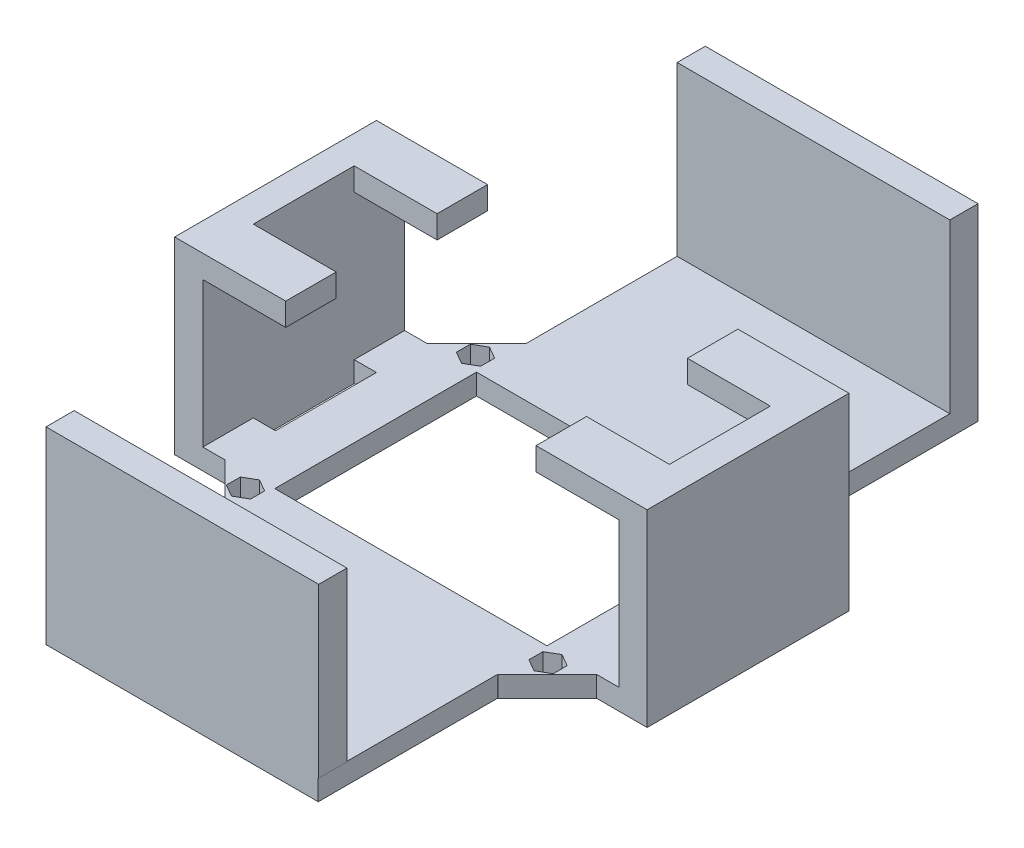
from build123d import *

# Parameters (mm, degrees)
BOSS_EXTRUDE1_DEPTH   = 20
BOSS_EXTRUDE1_2_DEPTH = 20
BOSS_EXTRUDE1_3_DEPTH = 20
BOSS_EXTRUDE1_4_DEPTH = 20
SKETCH6_W             = 12
SKETCH6_H             = 5
BOSS_EXTRUDE5_DEPTH   = 65.8
SKETCH7_W             = 12
SKETCH7_H             = 5
BOSS_EXTRUDE6_DEPTH   = 48.7
SKETCH8_W             = 12.175
SKETCH8_H             = 5
BOSS_EXTRUDE7_DEPTH   = 12.16
SKETCH9_W             = 12.175
SKETCH9_H             = 5
BOSS_EXTRUDE8_DEPTH   = 12.16
SKETCH11_W            = 6.8
SKETCH11_H            = 12.175
BOSS_EXTRUDE9_DEPTH   = 40.5
SKETCH12_W            = 12.175
SKETCH12_H            = 5.5
BOSS_EXTRUDE10_DEPTH  = 20
SKETCH13_W            = 12.175
SKETCH13_H            = 5.5
BOSS_EXTRUDE11_DEPTH  = 20
SKETCH14_W            = 12.175
SKETCH14_H            = 5
BOSS_EXTRUDE12_DEPTH  = 43.2
SKETCH15_W            = 12.175
SKETCH15_H            = 5
BOSS_EXTRUDE13_DEPTH  = 43.2
SKETCH16_W            = 12.175
SKETCH16_H            = 6.8
BOSS_EXTRUDE14_DEPTH  = 40.5
SKETCH17_W            = 16.970562748
SKETCH17_H            = 15
CUT_EXTRUDE1_DEPTH    = 10
SKETCH18_W            = 16.970562748
SKETCH18_H            = 15
CUT_EXTRUDE2_DEPTH    = 10
SKETCH19_W            = 16.970562748
SKETCH19_H            = 15
CUT_EXTRUDE3_DEPTH    = 10
SKETCH20_W            = 16.970562748
SKETCH20_H            = 15
CUT_EXTRUDE4_DEPTH    = 10
BOSS_EXTRUDE15_DEPTH  = 50
BOSS_EXTRUDE19_DEPTH  = 30


with BuildPart() as part:
    # Sketch2 → Boss-Extrude1 (new body)
    with BuildSketch(Plane(origin=(0, 0, 0), x_dir=(1, 0, 0), z_dir=(0, 1, 0))):
        Polygon((-32.84355613, 36.339660101), (-32.84355613, 24.339660101), (-44.84355613, 24.339660101), align=None)
        Polygon((-33.575, 29.438749537), (-33.575, 26.061250463), (-36.5, 24.372500925), (-39.425, 26.061250463), (-39.425, 29.438749537), (-36.5, 31.127499075), align=None, mode=Mode.SUBTRACT)
    extrude(amount=BOSS_EXTRUDE1_DEPTH)



with BuildPart() as body_2:
    # Sketch2 → Boss-Extrude1 2 (new body)
    with BuildSketch(Plane(origin=(0, 0, 0), x_dir=(1, 0, 0), z_dir=(0, 1, 0))):
        Polygon((32.84355613, 24.339660101), (44.84355613, 24.339660101), (32.84355613, 36.339660101), align=None)
        Polygon((33.575, 29.438749537), (33.575, 26.061250463), (36.5, 24.372500925), (39.425, 26.061250463), (39.425, 29.438749537), (36.5, 31.127499075), align=None, mode=Mode.SUBTRACT)
    extrude(amount=BOSS_EXTRUDE1_2_DEPTH)


with BuildPart() as body_3:
    # Sketch2 → Boss-Extrude1 3 (new body)
    with BuildSketch(Plane(origin=(0, 0, 0), x_dir=(1, 0, 0), z_dir=(0, 1, 0))):
        Polygon((44.84355613, -24.339660101), (32.84355613, -36.339660101), (32.84355613, -24.339660101), align=None)
        Polygon((39.425, -26.061250463), (39.425, -29.438749537), (36.5, -31.127499075), (33.575, -29.438749537), (33.575, -26.061250463), (36.5, -24.372500925), align=None, mode=Mode.SUBTRACT)
    extrude(amount=BOSS_EXTRUDE1_3_DEPTH)


with BuildPart() as body_4:
    # Sketch2 → Boss-Extrude1 4 (new body)
    with BuildSketch(Plane(origin=(0, 0, 0), x_dir=(1, 0, 0), z_dir=(0, 1, 0))):
        Polygon((-44.84355613, -24.339660101), (-32.84355613, -36.339660101), (-32.84355613, -24.339660101), align=None)
        Polygon((-36.5, -31.127499075), (-33.575, -29.438749537), (-33.575, -26.061250463), (-36.5, -24.372500925), (-39.425, -26.061250463), (-39.425, -29.438749537), align=None, mode=Mode.SUBTRACT)
    extrude(amount=BOSS_EXTRUDE1_4_DEPTH)


with BuildPart() as part_1:
    add(part.part)

    add(body_2.part)  # Boss-Extrude5 merges body 2

    add(body_3.part)  # Boss-Extrude5 merges body 3

    add(body_4.part)  # Boss-Extrude5 merges body 4
    # Sketch6 → Boss-Extrude5 (add)
    with BuildSketch(Plane(origin=(-32.84355613, 0, 0), x_dir=(0, 0, -1), z_dir=(1, 0, 0))):
        with Locations((30.339660101, 17.5)):
            Rectangle(SKETCH6_W, SKETCH6_H)
        with Locations((-30.339660101, 17.5)):
            Rectangle(SKETCH6_W, SKETCH6_H)
    extrude(amount=BOSS_EXTRUDE5_DEPTH)

    # Sketch7 → Boss-Extrude6 (add)
    with BuildSketch(Plane(origin=(0, 0, 24.339660101), x_dir=(-1, 0, 0), z_dir=(0, 0, -1))):
        with Locations((-38.84355613, 17.5)):
            Rectangle(SKETCH7_W, SKETCH7_H)
        with Locations((38.84355613, 17.5)):
            Rectangle(SKETCH7_W, SKETCH7_H)
    extrude(amount=BOSS_EXTRUDE6_DEPTH)

    # Sketch8 → Boss-Extrude7 (add)
    with BuildSketch(Plane(origin=(44.84355613, 0, 0), x_dir=(0, 0, -1), z_dir=(1, 0, 0))):
        with Locations((-18.252160101, 17.5)):
            Rectangle(SKETCH8_W, SKETCH8_H)
        with Locations((18.272839899, 17.5)):
            Rectangle(SKETCH8_W, SKETCH8_H)
    extrude(amount=BOSS_EXTRUDE7_DEPTH)

    # Sketch9 → Boss-Extrude8 (add)
    with BuildSketch(Plane.ZY.offset(44.84355613)):
        with Locations((-18.272839899, 17.5)):
            Rectangle(SKETCH9_W, SKETCH9_H)
        with Locations((18.252160101, 17.5)):
            Rectangle(SKETCH9_W, SKETCH9_H)
    extrude(amount=BOSS_EXTRUDE8_DEPTH)

    # Sketch11 → Boss-Extrude9 (add)
    with BuildSketch(Plane(origin=(0, 20, 0), x_dir=(1, 0, 0), z_dir=(0, 1, 0))):
        with Locations((-53.60355613, -18.252160101)):
            Rectangle(SKETCH11_W, SKETCH11_H)
        with Locations((-53.60355613, 18.272839899)):
            Rectangle(SKETCH11_W, SKETCH11_H)
        with Locations((53.60355613, 18.272839899)):
            Rectangle(SKETCH11_W, SKETCH11_H)
        with Locations((53.60355613, -18.252160101)):
            Rectangle(SKETCH11_W, SKETCH11_H)
    extrude(amount=BOSS_EXTRUDE9_DEPTH)

    # Sketch12 → Boss-Extrude10 (add)
    with BuildSketch(Plane(origin=(-50.20355613, 0, 0), x_dir=(0, 0, -1), z_dir=(1, 0, 0))):
        with Locations((-18.252160101, 57.75)):
            Rectangle(SKETCH12_W, SKETCH12_H)
        with Locations((18.272839899, 57.75)):
            Rectangle(SKETCH12_W, SKETCH12_H)
    extrude(amount=BOSS_EXTRUDE10_DEPTH)

    # Sketch13 → Boss-Extrude11 (add)
    with BuildSketch(Plane.ZY.offset(-50.20355613)):
        with Locations((-18.272839899, 57.75)):
            Rectangle(SKETCH13_W, SKETCH13_H)
        with Locations((18.252160101, 57.75)):
            Rectangle(SKETCH13_W, SKETCH13_H)
    extrude(amount=BOSS_EXTRUDE11_DEPTH)

    # Sketch14 → Boss-Extrude12 (add)
    with BuildSketch(Plane.XY.offset(36.339660101)):
        with Locations((-26.75605613, 17.5)):
            Rectangle(SKETCH14_W, SKETCH14_H)
        with Locations((26.75605613, 17.5)):
            Rectangle(SKETCH14_W, SKETCH14_H)
    extrude(amount=BOSS_EXTRUDE12_DEPTH)

    # Sketch15 → Boss-Extrude13 (add)
    with BuildSketch(Plane(origin=(0, 0, -36.339660101), x_dir=(-1, 0, 0), z_dir=(0, 0, -1))):
        with Locations((-26.86894387, 17.5)):
            Rectangle(SKETCH15_W, SKETCH15_H)
        with Locations((26.75605613, 17.5)):
            Rectangle(SKETCH15_W, SKETCH15_H)
    extrude(amount=BOSS_EXTRUDE13_DEPTH)

    # Sketch16 → Boss-Extrude14 (add)
    with BuildSketch(Plane(origin=(0, 20, 0), x_dir=(1, 0, 0), z_dir=(0, 1, 0))):
        with Locations((-26.75605613, 76.139660101)):
            Rectangle(SKETCH16_W, SKETCH16_H)
        with Locations((26.86894387, 76.139660101)):
            Rectangle(SKETCH16_W, SKETCH16_H)
        with Locations((26.86894387, -76.139660101)):
            Rectangle(SKETCH16_W, SKETCH16_H)
        with Locations((-26.75605613, -76.139660101)):
            Rectangle(SKETCH16_W, SKETCH16_H)
    extrude(amount=BOSS_EXTRUDE14_DEPTH)

    # Sketch17 → Cut-Extrude1 (cut)
    with BuildSketch(Plane(origin=(34.591608116, 0, -34.591608116), x_dir=(-0.7071067811865475, 0, -0.7071067811865477), z_dir=(0.7071067811865477, 0, -0.7071067811865475))):
        with Locations((-6.013162549, 7.5)):
            Rectangle(SKETCH17_W, SKETCH17_H)
    extrude(amount=-CUT_EXTRUDE1_DEPTH, mode=Mode.SUBTRACT)

    # Sketch18 → Cut-Extrude2 (cut)
    with BuildSketch(Plane(origin=(-34.591608116, 0, -34.591608116), x_dir=(-0.7071067811865475, 0, 0.7071067811865477), z_dir=(-0.7071067811865477, 0, -0.7071067811865475))):
        with Locations((6.013162549, 7.5)):
            Rectangle(SKETCH18_W, SKETCH18_H)
    extrude(amount=-CUT_EXTRUDE2_DEPTH, mode=Mode.SUBTRACT)

    # Sketch19 → Cut-Extrude3 (cut)
    with BuildSketch(Plane(origin=(-34.591608116, 0, 34.591608116), x_dir=(0.7071067811865475, 0, 0.7071067811865477), z_dir=(-0.7071067811865477, 0, 0.7071067811865475))):
        with Locations((-6.013162549, 7.5)):
            Rectangle(SKETCH19_W, SKETCH19_H)
    extrude(amount=-CUT_EXTRUDE3_DEPTH, mode=Mode.SUBTRACT)

    # Sketch20 → Cut-Extrude4 (cut)
    with BuildSketch(Plane(origin=(34.591608116, 0, 34.591608116), x_dir=(0.7071067811865475, 0, -0.7071067811865477), z_dir=(0.7071067811865477, 0, 0.7071067811865475))):
        with Locations((6.013162549, 7.5)):
            Rectangle(SKETCH20_W, SKETCH20_H)
    extrude(amount=-CUT_EXTRUDE4_DEPTH, mode=Mode.SUBTRACT)

    # Sketch21 → Boss-Extrude15 (add)
    with BuildSketch(Plane(origin=(-20.66855613, 0, 0), x_dir=(0, 0, -1), z_dir=(1, 0, 0))):
        Polygon((-79.539660101, 60.5), (-72.739660101, 60.5), (-72.739660101, 20), (-36.339660101, 20), (-36.339660101, 15), (-79.539660101, 15), align=None)
        Polygon((79.539660101, 60.5), (72.739660101, 60.5), (72.739660101, 20), (36.339660101, 20), (36.339660101, 15), (79.539660101, 15), align=None)
    extrude(amount=BOSS_EXTRUDE15_DEPTH)

    # Sketch22 → Boss-Extrude19 (add)
    with BuildSketch(Plane(origin=(0, 0, 12.164660101), x_dir=(-1, 0, 0), z_dir=(0, 0, -1))):
        Polygon((-50.20355613, 55), (-50.20355613, 20), (-50.20355613, 15), (-57.00355613, 15), (-57.00355613, 20), (-57.00355613, 60.5), (-50.20355613, 60.5), align=None)
        Polygon((57.00355613, 60.5), (57.00355613, 20), (57.00355613, 15), (50.20355613, 15), (50.20355613, 20), (50.20355613, 55), (50.20355613, 60.5), align=None)
    extrude(amount=BOSS_EXTRUDE19_DEPTH)


solid = part_1.part
